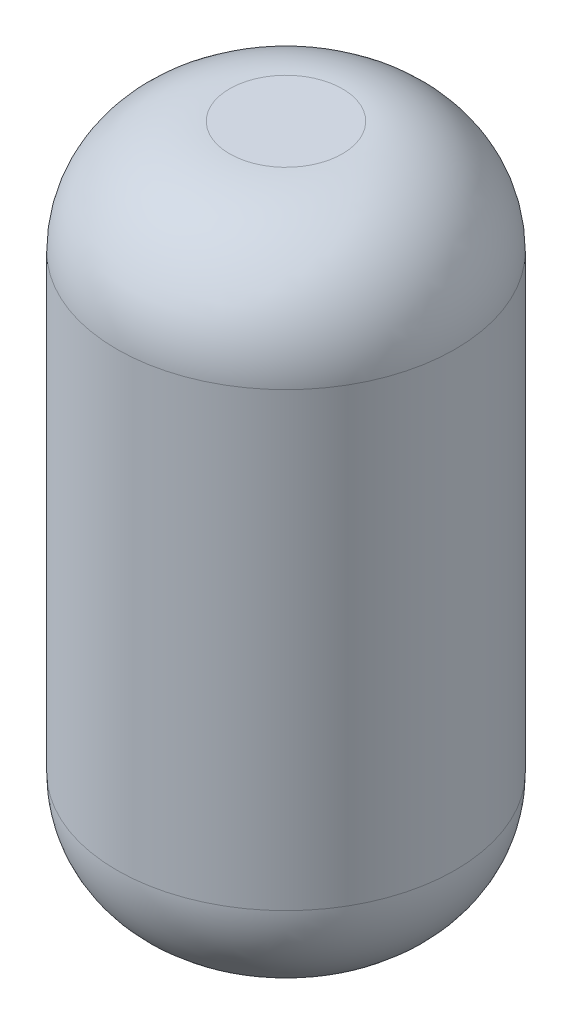
from build123d import *

# Parameters (mm, degrees)
SKETCH2_R          = 9.525
BASE_EXTRUDE_DEPTH = 38.1
FILLET1_R          = 6.35


with BuildPart() as part:
    # Sketch2 → Base-Extrude (new body)
    with BuildSketch(Plane(origin=(0, 0, 0), x_dir=(1, 0, 0), z_dir=(0, 1, 0))):
        Circle(SKETCH2_R)
    extrude(amount=BASE_EXTRUDE_DEPTH)

    # Fillet1
    fillet1_edges = [part.edges().sort_by_distance(p)[0] for p in [
        (-9.525, 38.1, 0),
        (-9.525, 0, 0),
    ]]
    fillet(fillet1_edges, radius=FILLET1_R)


solid = part.part
